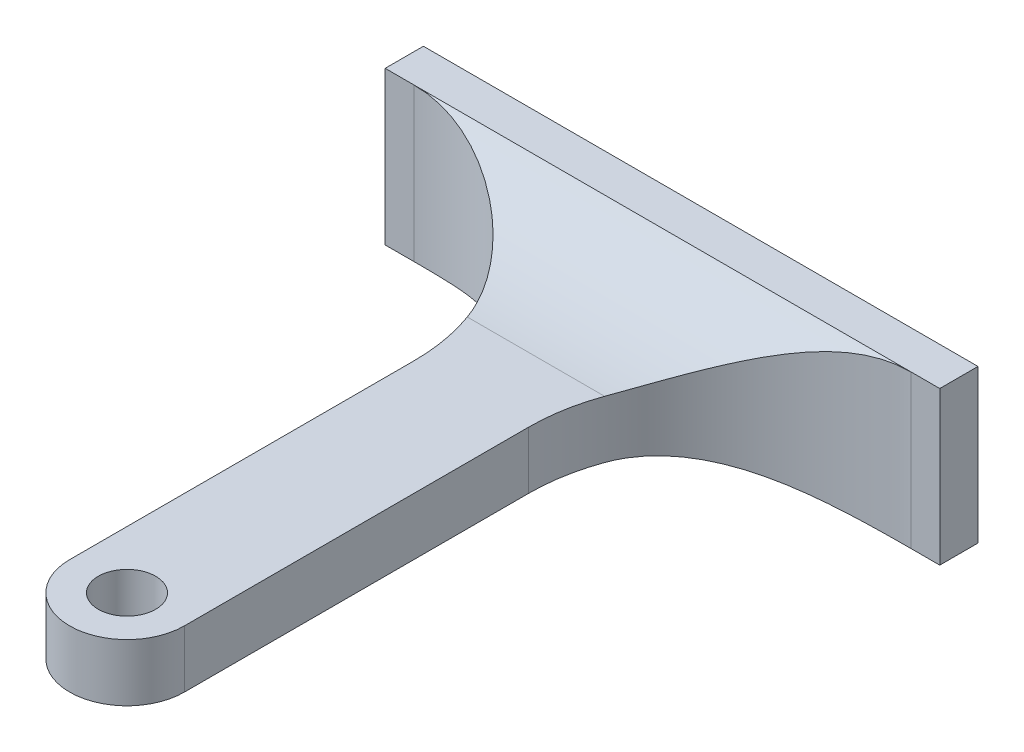
from build123d import *

# Parameters (mm, degrees)
SKETCH1_W           = 29
SKETCH1_H           = 8
BOSS_EXTRUDE1_DEPTH = 2
SKETCH2_R           = 1.5
BOSS_EXTRUDE2_DEPTH = 1.5
FILLET1_R           = 10


with BuildPart() as part:
    # Sketch1 → Boss-Extrude1 (new body)
    with BuildSketch(Plane.XY):
        Rectangle(SKETCH1_W, SKETCH1_H)
    extrude(amount=BOSS_EXTRUDE1_DEPTH)

    # Sketch2 → Boss-Extrude2 (add, symmetric)
    with BuildSketch(Plane(origin=(0, 0, 0), x_dir=(1, 0, 0), z_dir=(0, 1, 0))):
        with BuildLine():
            Line((-3, -2), (3, -2))
            Line((3, -2), (3, -30))
            ThreePointArc((3, -30), (0, -33), (-3, -30))
            Line((-3, -30), (-3, -2))
        make_face()
        with Locations(Location((0, -30, 0), (0, 0, 270))):
            Circle(SKETCH2_R, mode=Mode.SUBTRACT)
    extrude(amount=BOSS_EXTRUDE2_DEPTH, both=True)

    # Fillet1
    # the kernel refuses this fillet: 10 mm, written as the material it adds along each edge
    with BuildSketch(Plane(origin=(-3, 1.5, 2), x_dir=(0, 1, 0), z_dir=(1, 0, 0))) as fillet1_piece_1:
        with BuildLine():
            CenterArc((10, 6.614378278), FILLET1_R, 180, 41.409622109)
            Line((0, 6.614378278), (-0.2, 6.614378278))
            Line((-0.2, 6.614378278), (-0.2, 0))
            Line((-0.2, 0), (0, -0.2))
            ThreePointArc((0, -0.2), (1.25, -0.2), (2.35, -0.132287566))
            Line((2.35, -0.132287566), (2.5, 0))
        make_face()
    extrude(amount=6)
    with BuildSketch(Plane(origin=(-3, -1.5, 2), x_dir=(-1, 0, 0), z_dir=(0, 1, 0)), Plane(origin=(3, 1.5, 2), x_dir=(1, 0, 0), z_dir=(0, -1, 0))) as fillet1_piece_2:
        with BuildLine():
            CenterArc((FILLET1_R, FILLET1_R), FILLET1_R, 180, 90)
            Line((0, FILLET1_R), (-FILLET1_R * 0.02, FILLET1_R))
            Line((-FILLET1_R * 0.02, FILLET1_R), (-FILLET1_R * 0.02, -FILLET1_R * 0.02))
            Line((-FILLET1_R * 0.02, -FILLET1_R * 0.02), (FILLET1_R, -FILLET1_R * 0.02))
            Line((FILLET1_R, -FILLET1_R * 0.02), (FILLET1_R, 0))
        make_face()
    extrude(amount=3)
    with BuildSketch(Plane(origin=(-3, -1.5, 2), x_dir=(0, -1, 0), z_dir=(1, 0, 0))) as fillet1_piece_3:
        with BuildLine():
            CenterArc((10, -6.614378278), FILLET1_R, 138.590377891, 41.409622109)
            Line((0, -6.614378278), (-0.2, -6.614378278))
            Line((-0.2, -6.614378278), (-0.2, 0))
            Line((-0.2, 0), (0, 0.2))
            ThreePointArc((0, 0.2), (1.25, 0.2), (2.35, 0.132287566))
            Line((2.35, 0.132287566), (2.5, 0))
        make_face()
    extrude(amount=6)
    with BuildSketch(Plane(origin=(-19.535945694, 1.5, 2), x_dir=(0, 1, 0), z_dir=(1, 0, 0))) as fillet1_piece_4a_section:
        with BuildLine():
            CenterArc((10, 6.614378278), FILLET1_R, 180, 41.409622109)
            Line((0, 6.614378278), (-0.2, 6.614378278))
            Line((-0.2, 6.614378278), (-0.2, 0))
            Line((-0.2, 0), (0, -0.2))
            ThreePointArc((0, -0.2), (1.25, -0.2), (2.35, -0.132287566))
            Line((2.35, -0.132287566), (2.5, 0))
        make_face()
    fillet1_piece_4a = extrude(amount=22.535945694, mode=Mode.PRIVATE)
    fillet1_piece_4a = split(fillet1_piece_4a, bisect_by=Plane(origin=(-14.5, 2.097749904, 3.814075663), z_dir=(1, 0, 0)), keep=Keep.TOP, mode=Mode.PRIVATE)
    fillet1_piece_4a = split(fillet1_piece_4a, bisect_by=Plane(origin=(-3, 2.097749904, 3.814075663), z_dir=(-1, 0, 0)), keep=Keep.TOP, mode=Mode.PRIVATE)
    with BuildSketch(Plane(origin=(-3, -1.5, 2), x_dir=(-1, 0, 0), z_dir=(0, 1, 0))) as fillet1_piece_4b_section:
        with BuildLine():
            CenterArc((FILLET1_R, FILLET1_R), FILLET1_R, 180, 90)
            Line((0, FILLET1_R), (-FILLET1_R * 0.02, FILLET1_R))
            Line((-FILLET1_R * 0.02, FILLET1_R), (-FILLET1_R * 0.02, -FILLET1_R * 0.02))
            Line((-FILLET1_R * 0.02, -FILLET1_R * 0.02), (FILLET1_R, -FILLET1_R * 0.02))
            Line((FILLET1_R, -FILLET1_R * 0.02), (FILLET1_R, 0))
        make_face()
    fillet1_piece_4b = extrude(amount=28, mode=Mode.PRIVATE)
    fillet1_piece_4b = split(fillet1_piece_4b, bisect_by=Plane(origin=(-5.263951143, 4, 4.263951143), z_dir=(0, -1, 0)), keep=Keep.TOP, mode=Mode.PRIVATE)
    fillet1_piece_4b = split(fillet1_piece_4b, bisect_by=Plane(origin=(-5.263951143, 1.5, 4.263951143), z_dir=(0, 1, 0)), keep=Keep.TOP, mode=Mode.PRIVATE)
    fillet1_piece_4 = fillet1_piece_4a & fillet1_piece_4b
    add(fillet1_piece_4)
    with BuildSketch(Plane(origin=(3, 26.5, 2), x_dir=(1, 0, 0), z_dir=(0, -1, 0))) as fillet1_piece_5a_section:
        with BuildLine():
            CenterArc((FILLET1_R, FILLET1_R), FILLET1_R, 180, 90)
            Line((0, FILLET1_R), (-FILLET1_R * 0.02, FILLET1_R))
            Line((-FILLET1_R * 0.02, FILLET1_R), (-FILLET1_R * 0.02, -FILLET1_R * 0.02))
            Line((-FILLET1_R * 0.02, -FILLET1_R * 0.02), (FILLET1_R, -FILLET1_R * 0.02))
            Line((FILLET1_R, -FILLET1_R * 0.02), (FILLET1_R, 0))
        make_face()
    fillet1_piece_5a = extrude(amount=28, mode=Mode.PRIVATE)
    fillet1_piece_5a = split(fillet1_piece_5a, bisect_by=Plane(origin=(5.263951143, 4, 4.263951143), z_dir=(0, -1, 0)), keep=Keep.TOP, mode=Mode.PRIVATE)
    fillet1_piece_5a = split(fillet1_piece_5a, bisect_by=Plane(origin=(5.263951143, 1.5, 4.263951143), z_dir=(0, 1, 0)), keep=Keep.TOP, mode=Mode.PRIVATE)
    with BuildSketch(Plane(origin=(-3, 1.5, 2), x_dir=(0, 1, 0), z_dir=(1, 0, 0))) as fillet1_piece_5b_section:
        with BuildLine():
            CenterArc((10, 6.614378278), FILLET1_R, 180, 41.409622109)
            Line((0, 6.614378278), (-0.2, 6.614378278))
            Line((-0.2, 6.614378278), (-0.2, 0))
            Line((-0.2, 0), (0, -0.2))
            ThreePointArc((0, -0.2), (1.25, -0.2), (2.35, -0.132287566))
            Line((2.35, -0.132287566), (2.5, 0))
        make_face()
    fillet1_piece_5b = extrude(amount=22.535945694, mode=Mode.PRIVATE)
    fillet1_piece_5b = split(fillet1_piece_5b, bisect_by=Plane(origin=(14.5, 2.097749904, 3.814075663), z_dir=(-1, 0, 0)), keep=Keep.TOP, mode=Mode.PRIVATE)
    fillet1_piece_5b = split(fillet1_piece_5b, bisect_by=Plane(origin=(3, 2.097749904, 3.814075663), z_dir=(1, 0, 0)), keep=Keep.TOP, mode=Mode.PRIVATE)
    fillet1_piece_5 = fillet1_piece_5a & fillet1_piece_5b
    add(fillet1_piece_5)
    with BuildSketch(Plane(origin=(-19.535945694, -1.5, 2), x_dir=(0, -1, 0), z_dir=(1, 0, 0))) as fillet1_piece_6a_section:
        with BuildLine():
            CenterArc((10, -6.614378278), FILLET1_R, 138.590377891, 41.409622109)
            Line((0, -6.614378278), (-0.2, -6.614378278))
            Line((-0.2, -6.614378278), (-0.2, 0))
            Line((-0.2, 0), (0, 0.2))
            ThreePointArc((0, 0.2), (1.25, 0.2), (2.35, 0.132287566))
            Line((2.35, 0.132287566), (2.5, 0))
        make_face()
    fillet1_piece_6a = extrude(amount=22.535945694, mode=Mode.PRIVATE)
    fillet1_piece_6a = split(fillet1_piece_6a, bisect_by=Plane(origin=(-14.5, -2.097749904, 3.814075663), z_dir=(1, 0, 0)), keep=Keep.TOP, mode=Mode.PRIVATE)
    fillet1_piece_6a = split(fillet1_piece_6a, bisect_by=Plane(origin=(-3, -2.097749904, 3.814075663), z_dir=(-1, 0, 0)), keep=Keep.TOP, mode=Mode.PRIVATE)
    with BuildSketch(Plane(origin=(-3, -26.5, 2), x_dir=(-1, 0, 0), z_dir=(0, 1, 0))) as fillet1_piece_6b_section:
        with BuildLine():
            CenterArc((FILLET1_R, FILLET1_R), FILLET1_R, 180, 90)
            Line((0, FILLET1_R), (-FILLET1_R * 0.02, FILLET1_R))
            Line((-FILLET1_R * 0.02, FILLET1_R), (-FILLET1_R * 0.02, -FILLET1_R * 0.02))
            Line((-FILLET1_R * 0.02, -FILLET1_R * 0.02), (FILLET1_R, -FILLET1_R * 0.02))
            Line((FILLET1_R, -FILLET1_R * 0.02), (FILLET1_R, 0))
        make_face()
    fillet1_piece_6b = extrude(amount=28, mode=Mode.PRIVATE)
    fillet1_piece_6b = split(fillet1_piece_6b, bisect_by=Plane(origin=(-5.263951143, -4, 4.263951143), z_dir=(0, 1, 0)), keep=Keep.TOP, mode=Mode.PRIVATE)
    fillet1_piece_6b = split(fillet1_piece_6b, bisect_by=Plane(origin=(-5.263951143, -1.5, 4.263951143), z_dir=(0, -1, 0)), keep=Keep.TOP, mode=Mode.PRIVATE)
    fillet1_piece_6 = fillet1_piece_6a & fillet1_piece_6b
    add(fillet1_piece_6)
    with BuildSketch(Plane(origin=(-3, -1.5, 2), x_dir=(0, -1, 0), z_dir=(1, 0, 0))) as fillet1_piece_7a_section:
        with BuildLine():
            CenterArc((10, -6.614378278), FILLET1_R, 138.590377891, 41.409622109)
            Line((0, -6.614378278), (-0.2, -6.614378278))
            Line((-0.2, -6.614378278), (-0.2, 0))
            Line((-0.2, 0), (0, 0.2))
            ThreePointArc((0, 0.2), (1.25, 0.2), (2.35, 0.132287566))
            Line((2.35, 0.132287566), (2.5, 0))
        make_face()
    fillet1_piece_7a = extrude(amount=22.535945694, mode=Mode.PRIVATE)
    fillet1_piece_7a = split(fillet1_piece_7a, bisect_by=Plane(origin=(14.5, -2.097749904, 3.814075663), z_dir=(-1, 0, 0)), keep=Keep.TOP, mode=Mode.PRIVATE)
    fillet1_piece_7a = split(fillet1_piece_7a, bisect_by=Plane(origin=(3, -2.097749904, 3.814075663), z_dir=(1, 0, 0)), keep=Keep.TOP, mode=Mode.PRIVATE)
    with BuildSketch(Plane(origin=(3, 1.5, 2), x_dir=(1, 0, 0), z_dir=(0, -1, 0))) as fillet1_piece_7b_section:
        with BuildLine():
            CenterArc((FILLET1_R, FILLET1_R), FILLET1_R, 180, 90)
            Line((0, FILLET1_R), (-FILLET1_R * 0.02, FILLET1_R))
            Line((-FILLET1_R * 0.02, FILLET1_R), (-FILLET1_R * 0.02, -FILLET1_R * 0.02))
            Line((-FILLET1_R * 0.02, -FILLET1_R * 0.02), (FILLET1_R, -FILLET1_R * 0.02))
            Line((FILLET1_R, -FILLET1_R * 0.02), (FILLET1_R, 0))
        make_face()
    fillet1_piece_7b = extrude(amount=28, mode=Mode.PRIVATE)
    fillet1_piece_7b = split(fillet1_piece_7b, bisect_by=Plane(origin=(5.263951143, -4, 4.263951143), z_dir=(0, 1, 0)), keep=Keep.TOP, mode=Mode.PRIVATE)
    fillet1_piece_7b = split(fillet1_piece_7b, bisect_by=Plane(origin=(5.263951143, -1.5, 4.263951143), z_dir=(0, -1, 0)), keep=Keep.TOP, mode=Mode.PRIVATE)
    fillet1_piece_7 = fillet1_piece_7a & fillet1_piece_7b
    add(fillet1_piece_7)


solid = part.part
